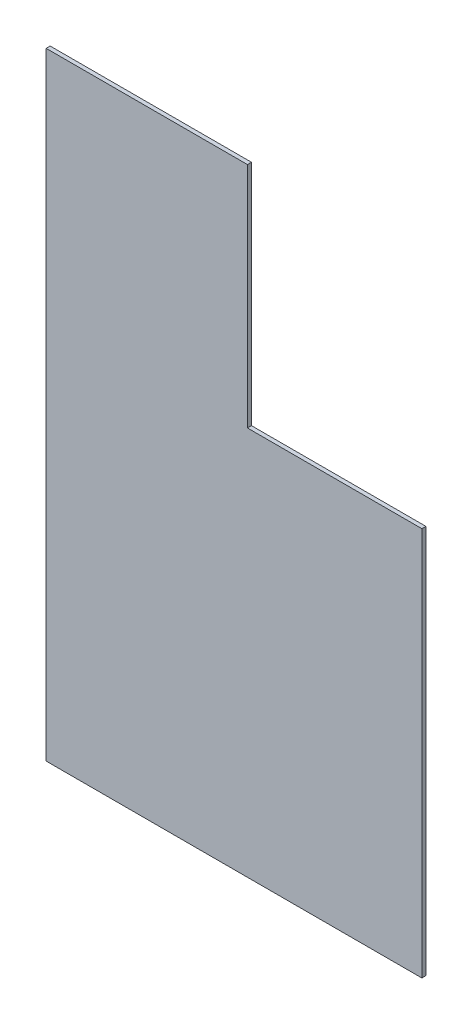
from build123d import *

# Parameters (mm, degrees)
BOSS_EXTRU_1_DEPTH = 3


with BuildPart() as part:
    # Esquisse1 → Boss.-Extru.1 (new body)
    with BuildSketch(Plane.XY):
        Polygon((-158.414514075, -408.671464143), (121.585485925, -408.671464143), (121.585485925, -118.671464143), (-8.414514075, -118.671464143), (-8.414514075, 51.328535857), (-158.414514075, 51.328535857), align=None)
    extrude(amount=BOSS_EXTRU_1_DEPTH)


solid = part.part
